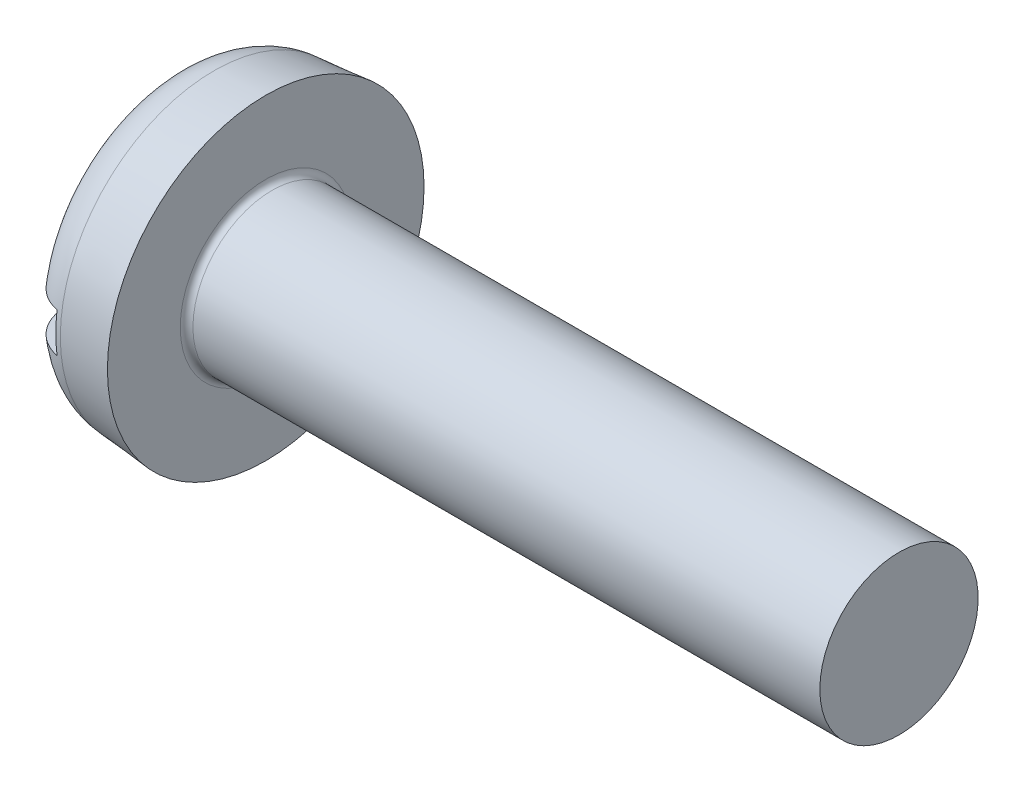
from build123d import *

# Parameters (mm, degrees)
FILLET_HEAD_R = 3
FILLET2_R     = 0.4
SLOTSKE_W     = 20
SLOTSKE_H     = 2.5
SLOT_DEPTH    = 2.4


with BuildPart() as part:
    # BodySke → BaseBody (revolve)
    with BuildSketch(Plane.XY):
        Polygon((0, 0), (0, 9.475068019), (6, 10), (6, 5), (46, 5), (46, 0), align=None)
    revolve(axis=Axis((0, 0, 0), (1, 0, 0)))

    # Fillet_head
    fillet_head_edges = [part.edges().sort_by_distance(p)[0] for p in [
        (0, -9.475068019, 0),
    ]]
    fillet(fillet_head_edges, radius=FILLET_HEAD_R)

    # Fillet2
    fillet2_edges = [part.edges().sort_by_distance(p)[0] for p in [
        (6, -5, 0),
    ]]
    fillet(fillet2_edges, radius=FILLET2_R)

    # SlotSke → Slot (cut)
    with BuildSketch(Plane.ZY):
        Rectangle(SLOTSKE_W, SLOTSKE_H)
    extrude(amount=-SLOT_DEPTH, mode=Mode.SUBTRACT)


solid = part.part
